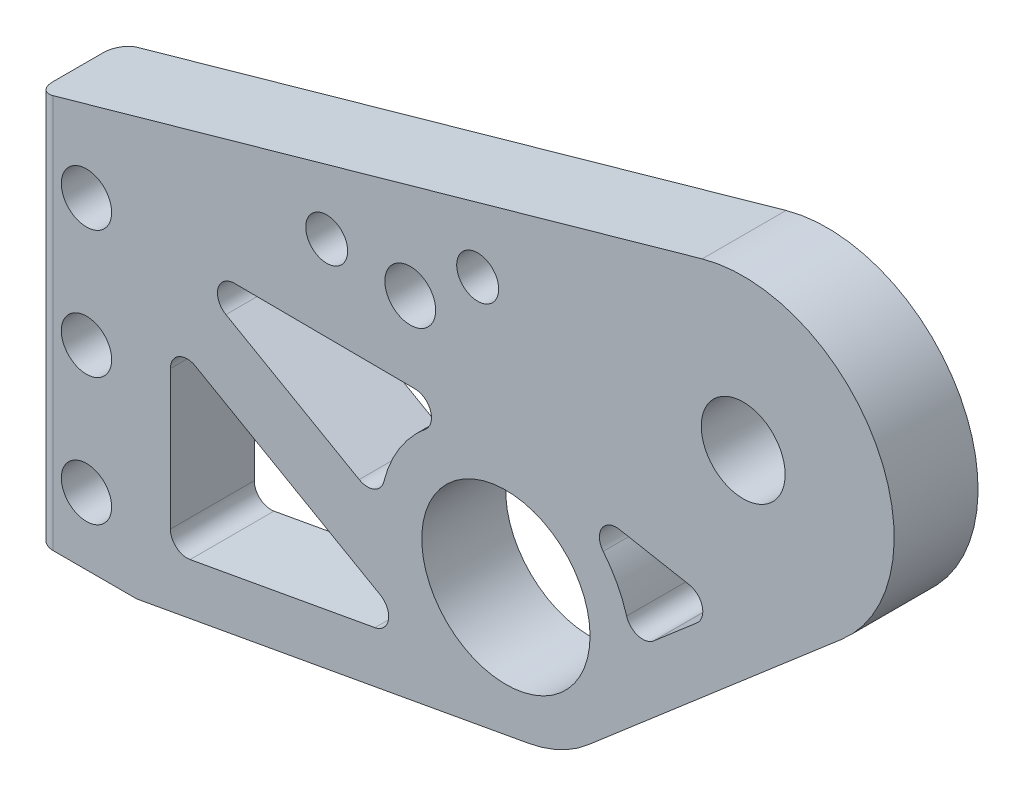
from build123d import *

# Parameters (mm, degrees)
SKETCH_1_R          = 1.5
SKETCH_1_R_2        = 5.015
SKETCH_1_R_3        = 2.5
SKETCH_1_R_4        = 1.515
SKETCH_1_R_5        = 1.25
EXTRUDE_1_DEPTH     = 5
FILLET_1_R          = 1
CUT_EXTRUDE_START   = -10
CUT_EXTRUDE_1_DEPTH = 10
FILLET_2_R          = 1
SKETCH_4_R          = 1.55
EXTRUDE_2_DEPTH     = 1


with BuildPart() as part:
    # 草图1 → 凸台-拉伸1 (new body)
    with BuildSketch(Plane.XY):
        with BuildLine():
            Line((0, 0), (0, 23.2))
            Line((0, 23.2), (39.697573244, 34.403781817))
            ThreePointArc((39.697573244, 34.403781817), (50.071662903, 29.999200004), (48.010875696, 18.918801397))
            Line((48.010875696, 18.918801397), (32.890616727, 5.913888145))
            ThreePointArc((32.890616727, 5.913888145), (31.225823282, 4.829175519), (29.3346121, 4.219701189))
            Line((29.3346121, 4.219701189), (6, 0))
            Line((6, 0), (0, 0))
        make_face()
        with Locations((3, 19.2)):
            Circle(SKETCH_1_R, mode=Mode.SUBTRACT)
        with Locations((3, 11.6)):
            Circle(SKETCH_1_R, mode=Mode.SUBTRACT)
        with Locations((3, 4)):
            Circle(SKETCH_1_R, mode=Mode.SUBTRACT)
        with Locations((28, 11.6)):
            Circle(SKETCH_1_R_2, mode=Mode.SUBTRACT)
        with Locations((42.142135624, 25.742135624)):
            Circle(SKETCH_1_R_3, mode=Mode.SUBTRACT)
        with Locations((22.298810634, 23.803988685)):
            Circle(SKETCH_1_R_4, mode=Mode.SUBTRACT)
        with Locations((17.318802705, 24.237631422)):
            Circle(SKETCH_1_R_5, mode=Mode.SUBTRACT)
        with Locations((26.317290694, 26.777260117)):
            Circle(SKETCH_1_R_5, mode=Mode.SUBTRACT)
    extrude(amount=EXTRUDE_1_DEPTH)

    # 圆角1
    fillet_1_edges = [part.edges().sort_by_distance(p)[0] for p in [
        (0, 11.6, 0),
        (0, 11.6, 5),
    ]]
    fillet(fillet_1_edges, radius=FILLET_1_R)

    # 草图3 → 切除-拉伸1 (cut)
    with BuildSketch(Plane.XY.offset(5).offset(CUT_EXTRUDE_START)):
        with BuildLine():
            Line((35.48325952, 12.100826268), (40.96881595, 16.818945558))
            Line((40.96881595, 16.818945558), (29.369933326, 18.973824156))
            ThreePointArc((29.369933326, 18.973824156), (33.603952256, 16.584548035), (35.48325952, 12.100826268))
        make_face()
        Polygon((8, 14.618103259), (8, 3.410325902), (22.896528211, 6.104131033), align=None)
        with BuildLine():
            Line((28.046942827, 19.09985309), (8, 19.225330237))
            Line((8, 19.225330237), (20.514901979, 12.072554345))
            ThreePointArc((20.514901979, 12.072554345), (22.883627253, 17.083860858), (28.046942827, 19.09985309))
        make_face()
    extrude(amount=CUT_EXTRUDE_1_DEPTH, mode=Mode.SUBTRACT)

    # 圆角2
    fillet_2_edges = [part.edges().sort_by_distance(p)[0] for p in [
        (22.896528211, 6.104131033, 2.5),
        (8, 3.410325902, 2.5),
        (29.369933326, 18.973824156, 2.5),
        (40.96881595, 16.818945558, 2.5),
        (35.48325952, 12.100826268, 2.5),
        (8, 14.618103259, 2.5),
        (20.514901979, 12.072554345, 2.5),
        (8, 19.225330237, 2.5),
    ]]
    fillet(fillet_2_edges, radius=FILLET_2_R)
    fillet_2_2_edges = [part.edges().sort_by_distance(p)[0] for p in [
        (28.046942827, 19.09985309, 2.5),
    ]]
    fillet(fillet_2_2_edges, radius=FILLET_2_R)


with BuildPart() as body_2:
    # 草图4 → 凸台-拉伸2 (new body)
    with BuildSketch(Plane(origin=(0, 0, 0), x_dir=(-1, 0, 0), z_dir=(0, 0, -1))):
        with BuildLine():
            Line((-27.803806286, 24.767217481), (-23.784643837, 21.794868765))
            ThreePointArc((-23.784643837, 21.794868765), (-22.977544022, 21.39908034), (-22.08261057, 21.314506672))
            Line((-22.08261057, 21.314506672), (-17.102503348, 21.747006081))
            ThreePointArc((-17.102503348, 21.747006081), (-14.829891944, 24.002422523), (-16.639757599, 26.643644253))
            Line((-16.639757599, 26.643644253), (-25.638245589, 29.183272948))
            ThreePointArc((-25.638245589, 29.183272948), (-28.561926214, 27.877992319), (-27.803806286, 24.767217481))
        make_face()
        with Locations((-26.317290694, 26.777260117)):
            Circle(SKETCH_4_R, mode=Mode.SUBTRACT)
        with Locations((-17.318802705, 24.237631422)):
            Circle(SKETCH_4_R, mode=Mode.SUBTRACT)
    extrude(amount=EXTRUDE_2_DEPTH)


solid = Compound([part.part, body_2.part])
